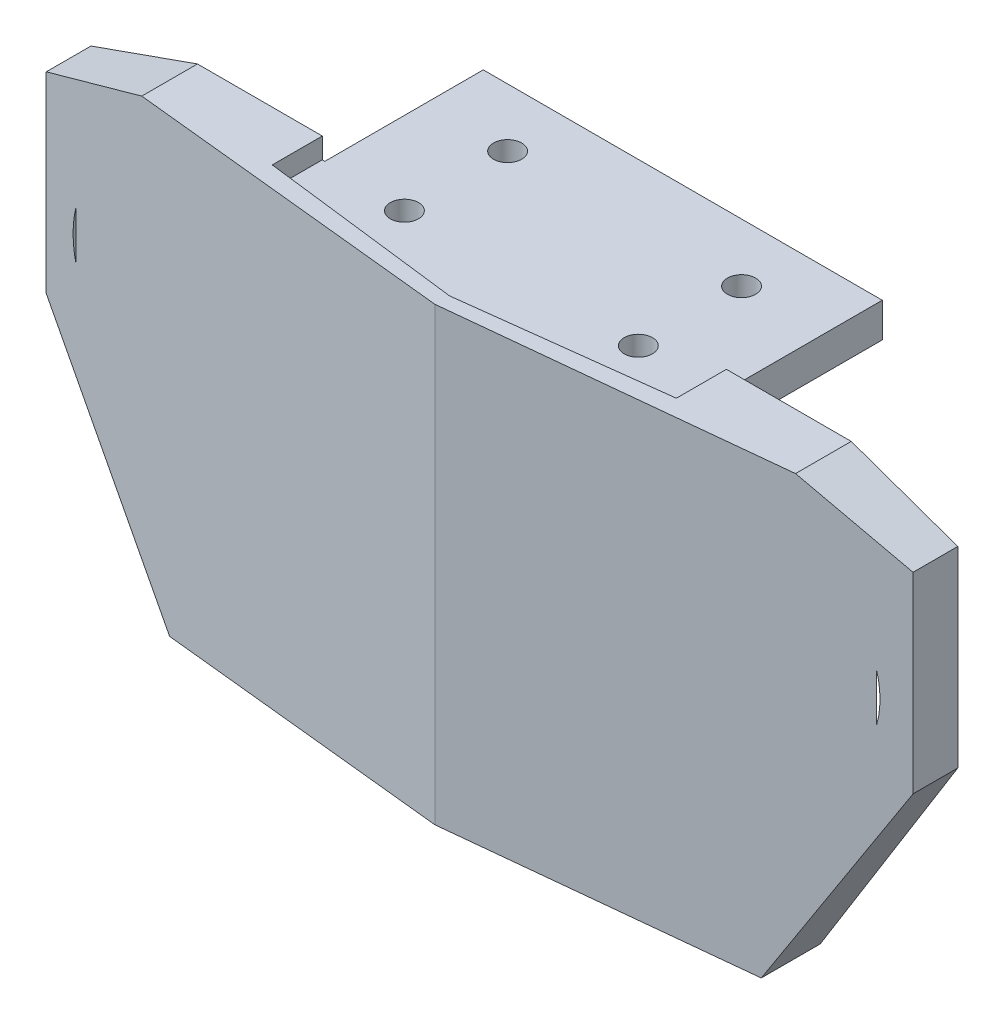
from build123d import *

# Parameters (mm, degrees)
SKETCH1_W                = 200
SKETCH1_H                = 60
BOSS_EXTRUDE1_DEPTH      = 25
SKETCH3_R                = 13.65
CUT_EXTRUDE1_DEPTH       = 7
CUT_EXTRUDE3_DEPTH       = 108.354552768
CUT_EXTRUDE7_DEPTH       = 45
FILLET8_R                = 5
SKETCH13_W               = 227.671202294
SKETCH13_H               = 68.392794906
SKETCH13_W_2             = 126
SKETCH13_H_2             = 41.42
CUT_EXTRUDE8_DEPTH       = 108.354552768
SKETCH14_W               = 12
SKETCH14_H               = 41.42
CUT_EXTRUDE9_DEPTH       = 131.573720174
CUT_EXTRUDE10_DEPTH      = 77.508930198
SKETCH19_W               = 126
SKETCH19_H               = 24.105748896
BOSS_EXTRUDE2_DEPTH      = 13
CUT_EXTRUDE11_DEPTH      = 77.508930198
CUT_EXTRUDE12_DEPTH      = 13
SKETCH22_W               = 58
SKETCH22_H               = 23.025801555
BOSS_EXTRUDE3_DEPTH      = 8
SKETCH24_W               = 40
SKETCH24_H               = 49.525748896
CUT_EXTRUDE13_DEPTH      = 4
CUT_EXTRUDE14_DEPTH      = 94.769991499
CUT_EXTRUDE14_DEPTH_BACK = 3
CUT_EXTRUDE15_DEPTH      = 94.769991499
CUT_EXTRUDE15_DEPTH_BACK = 3
SKETCH27_R               = 2.05
CUT_EXTRUDE16_DEPTH      = 92.69872852


with BuildPart() as part:
    # Sketch1 → Boss-Extrude1 (new body)
    with BuildSketch(Plane.XY):
        Rectangle(SKETCH1_W, SKETCH1_H)
    extrude(amount=BOSS_EXTRUDE1_DEPTH)

    # Sketch3 → Cut-Extrude1 (cut)
    with BuildSketch(Plane(origin=(0, 0, 0), x_dir=(-1, 0, 0), z_dir=(0, 0, -1))):
        with Locations((-45, 0)):
            Circle(SKETCH3_R)
        with Locations((45, 0)):
            Circle(SKETCH3_R)
    extrude(amount=-CUT_EXTRUDE1_DEPTH, mode=Mode.SUBTRACT)

    # Sketch6 → Cut-Extrude3 (cut, through all)
    with BuildSketch(Plane(origin=(0, 0, 0), x_dir=(-1, 0, 0), z_dir=(0, 0, -1))):
        Polygon((-87.020750536, 30), (-100, 15.531551678), (-100, 30), align=None)
        Polygon((-100, -15.090940283), (-89.003501814, -30), (-100, -30), align=None)
        Polygon((100, -15.090940283), (89.003501814, -30), (100, -30), align=None)
        Polygon((87.020750536, 30), (100, 15.531551678), (100, 30), align=None)
    extrude(amount=-CUT_EXTRUDE3_DEPTH, mode=Mode.SUBTRACT)

    # Sketch11 → Cut-Extrude7 (cut)
    with BuildSketch(Plane(origin=(0, 0, 0), x_dir=(-1, 0, 0), z_dir=(0, 0, -1))):
        Polygon((8.001444911, 30), (-99.028209758, 30), (-99.028209758, 24.58), (8.001444911, 24.58), (98.384596387, 24.58), (98.384596387, 30), align=None)
    extrude(amount=-CUT_EXTRUDE7_DEPTH, mode=Mode.SUBTRACT)

    # Fillet8
    fillet8_edges = [part.edges().sort_by_distance(p)[0] for p in [
        (100, 0.220305698, 25),
        (94.501750907, -22.545470141, 25),
        (0, -30, 25),
        (-94.501750907, -22.545470141, 25),
        (-100, 0.220305698, 25),
        (95.941442184, 20.055775839, 25),
        (-95.941442184, 20.055775839, 25),
        (0, 24.58, 25),
    ]]
    fillet(fillet8_edges, radius=FILLET8_R)

    # Sketch13 → Cut-Extrude8 (cut, through all)
    with BuildSketch(Plane(origin=(0, 0, 0), x_dir=(-1, 0, 0), z_dir=(0, 0, -1))):
        with Locations((1.665204381, -2.689234518)):
            Rectangle(SKETCH13_W, SKETCH13_H)
        with Locations((0, 2.71)):
            Rectangle(SKETCH13_W_2, SKETCH13_H_2, mode=Mode.SUBTRACT)
    extrude(amount=-CUT_EXTRUDE8_DEPTH, mode=Mode.SUBTRACT)

    # Sketch14 → Cut-Extrude9 (cut, through all)
    with BuildSketch(Plane(origin=(63, 0, 0), x_dir=(0, 0, -1), z_dir=(1, 0, 0))):
        with Locations((-19, 2.71)):
            Rectangle(SKETCH14_W, SKETCH14_H)
    extrude(amount=-CUT_EXTRUDE9_DEPTH, mode=Mode.SUBTRACT)

    # Sketch15 → Cut-Extrude10 (cut, through all)
    with BuildSketch(Plane(origin=(0, 23.42, 0), x_dir=(1, 0, 0), z_dir=(0, 1, 0))):
        Polygon((63, -6.5), (0, -13), (63, -13), align=None)
        Polygon((0, -13), (-63, -6.5), (-63, -13), align=None)
    extrude(amount=-CUT_EXTRUDE10_DEPTH, mode=Mode.SUBTRACT)

    # Sketch19 → Boss-Extrude2 (add)
    with BuildSketch(Plane(origin=(0, 0, 0), x_dir=(-1, 0, 0), z_dir=(0, 0, -1))):
        with Locations((0, -30.052874448)):
            Rectangle(SKETCH19_W, SKETCH19_H)
    extrude(amount=-BOSS_EXTRUDE2_DEPTH)

    # Sketch20 → Cut-Extrude11 (cut, through all)
    with BuildSketch(Plane(origin=(0, -18, 0), x_dir=(1, 0, 0), z_dir=(0, 1, 0))):
        Polygon((0, -13), (-63, -6.5), (-63, -13), align=None)
        Polygon((63, -6.5), (0, -13), (63, -13), align=None)
    extrude(amount=-CUT_EXTRUDE11_DEPTH, mode=Mode.SUBTRACT)

    # Sketch21 → Cut-Extrude12 (cut)
    with BuildSketch(Plane(origin=(0, 0, 0), x_dir=(-1, 0, 0), z_dir=(0, 0, -1))):
        Polygon((-63, -9.957970409), (-43, -42.105748896), (-63, -42.105748896), align=None)
        Polygon((-47.515984788, 23.42), (-63, 17.935984788), (-63, 23.42), align=None)
    cut_extrude12 = extrude(amount=-CUT_EXTRUDE12_DEPTH, mode=Mode.SUBTRACT)

    # Mirror1: Cut-Extrude12 across plane
    add(cut_extrude12.mirror(Plane(origin=(0, 0, 0), x_dir=(0, 0, 1), z_dir=(1, 0, 0))), mode=Mode.SUBTRACT)

    # Sketch22 → Boss-Extrude3 (add)
    with BuildSketch(Plane(origin=(0, 23.42, 0), x_dir=(1, 0, 0), z_dir=(0, 1, 0))):
        with Locations((0, 11.512900778)):
            Rectangle(SKETCH22_W, SKETCH22_H)
    boss_extrude3 = extrude(amount=-BOSS_EXTRUDE3_DEPTH)

    # Mirror2: Boss-Extrude3 across plane
    add(boss_extrude3.mirror(Plane(origin=(0, -9.342874448, 0), x_dir=(0, 0, 1), z_dir=(0, -1, 0))))

    # Sketch24 → Cut-Extrude13 (cut)
    with BuildSketch(Plane(origin=(0, 0, 0), x_dir=(-1, 0, 0), z_dir=(0, 0, -1))):
        with Locations((0, -9.342874448)):
            Rectangle(SKETCH24_W, SKETCH24_H)
    extrude(amount=-CUT_EXTRUDE13_DEPTH, mode=Mode.SUBTRACT)

    # Sketch25 → Cut-Extrude14 (cut, two sides: drawn at the far end of the back side and taken through both)
    with BuildSketch(Plane(origin=(0, 23.42, 0), x_dir=(1, 0, 0), z_dir=(0, 1, 0)).offset(-CUT_EXTRUDE14_DEPTH_BACK)):
        Polygon((29, 230.630036101), (29, 23.025801555), (29, 0), (29.370193256, 0), (29.370193256, -7.27376555), (0, -10.875770383), (-29.370193256, -7.27376555), (-29.370193256, 0), (-29, 0), (-29, 23.025801555), (-29, 230.630036101), (-29, 645.838505193), (29, 645.838505193), align=None)
    extrude(amount=CUT_EXTRUDE14_DEPTH + CUT_EXTRUDE14_DEPTH_BACK, mode=Mode.SUBTRACT)

    # Sketch26 → Cut-Extrude15 (cut, two sides: drawn at the far end of the back side and taken through both)
    with BuildSketch(Plane.XZ.offset(42.105748896).offset(-CUT_EXTRUDE15_DEPTH_BACK)):
        Polygon((29, -230.630036101), (29, -23.025801555), (29, 0), (29.37, 0), (29.37, 7.84856116), (0, 10.878799255), (-29.37, 7.84856116), (-29.37, 0), (-29, 0), (-29, -23.025801555), (-29, -230.630036101), (-29, -645.838505193), (29, -645.838505193), align=None)
    extrude(amount=CUT_EXTRUDE15_DEPTH + CUT_EXTRUDE15_DEPTH_BACK, mode=Mode.SUBTRACT)

    # Sketch27 → Cut-Extrude16 (cut, through all)
    with BuildSketch(Plane(origin=(0, 20.42, 0), x_dir=(1, 0, 0), z_dir=(0, 1, 0))):
        with Locations((17, -0.433798275)):
            Circle(SKETCH27_R)
        with Locations((-17, -0.433798275)):
            Circle(SKETCH27_R)
        with Locations((-17, 14.566201725)):
            Circle(SKETCH27_R)
        with Locations((17, 14.566201725)):
            Circle(SKETCH27_R)
    extrude(amount=-CUT_EXTRUDE16_DEPTH, mode=Mode.SUBTRACT)


solid = part.part
